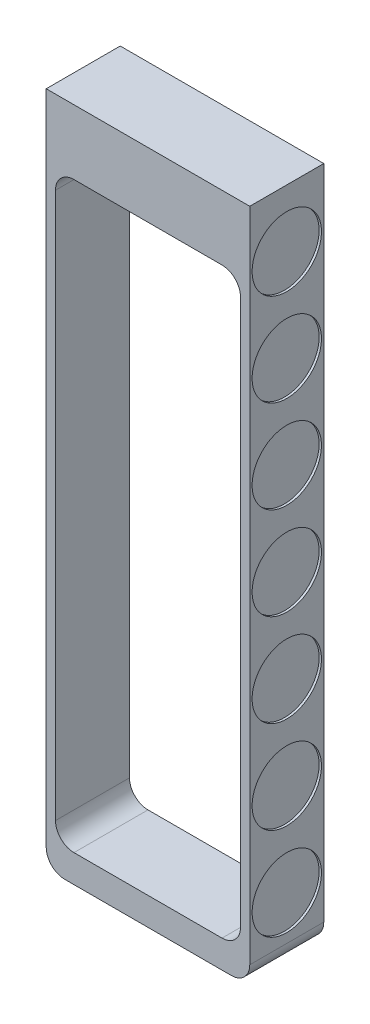
from build123d import *

# Parameters (mm, degrees)
SKETCH_1_W          = 44
SKETCH_1_H          = 146
EXTRUDE_1_DEPTH     = 16
SKETCH_2_W          = 40
SKETCH_2_H          = 126
CUT_EXTRUDE_1_DEPTH = 154.32318807
FILLET_1_R          = 4
FILLET_2_R          = 4
SKETCH_3_R          = 7.5
CUT_EXTRUDE_2_DEPTH = 0.5


with BuildPart() as part:
    # Эскиз1 → Бобышка-Вытянуть1 (new body)
    with BuildSketch(Plane.XY):
        with Locations((22, 73)):
            Rectangle(SKETCH_1_W, SKETCH_1_H)
    extrude(amount=EXTRUDE_1_DEPTH)

    # Эскиз2 → Вырез-Вытянуть1 (cut, through all)
    with BuildSketch(Plane.XY.offset(16)):
        with Locations((22, 69)):
            Rectangle(SKETCH_2_W, SKETCH_2_H)
    extrude(amount=-CUT_EXTRUDE_1_DEPTH, mode=Mode.SUBTRACT)

    # Скругление1
    fillet_1_edges = [part.edges().sort_by_distance(p)[0] for p in [
        (44, 0, 8),
        (0, 0, 8),
    ]]
    fillet(fillet_1_edges, radius=FILLET_1_R)

    # Скругление2
    fillet_2_edges = [part.edges().sort_by_distance(p)[0] for p in [
        (42, 132, 8),
        (2, 132, 8),
        (42, 6, 8),
        (2, 6, 8),
    ]]
    fillet(fillet_2_edges, radius=FILLET_2_R)

    # Эскиз3 → Вырез-Вытянуть2 (cut)
    with BuildSketch(Plane.ZY):
        with Locations((8, 133.520382793)):
            Circle(SKETCH_3_R)
        with Locations((8, 113.520382793)):
            Circle(SKETCH_3_R)
        with Locations((8, 93.520382793)):
            Circle(SKETCH_3_R)
        with Locations((8, 73.520382793)):
            Circle(SKETCH_3_R)
        with Locations((8, 53.520382793)):
            Circle(SKETCH_3_R)
        with Locations((8, 33.520382793)):
            Circle(SKETCH_3_R)
        with Locations((8, 13.520382793)):
            Circle(SKETCH_3_R)
    cut_extrude_2 = extrude(amount=-CUT_EXTRUDE_2_DEPTH, mode=Mode.SUBTRACT)

    # Зеркальное отражение1: Вырез-Вытянуть2 across plane
    add(cut_extrude_2.mirror(Plane(origin=(22, 0, 0), x_dir=(0, 0, 1), z_dir=(1, 0, 0))), mode=Mode.SUBTRACT)


solid = part.part
